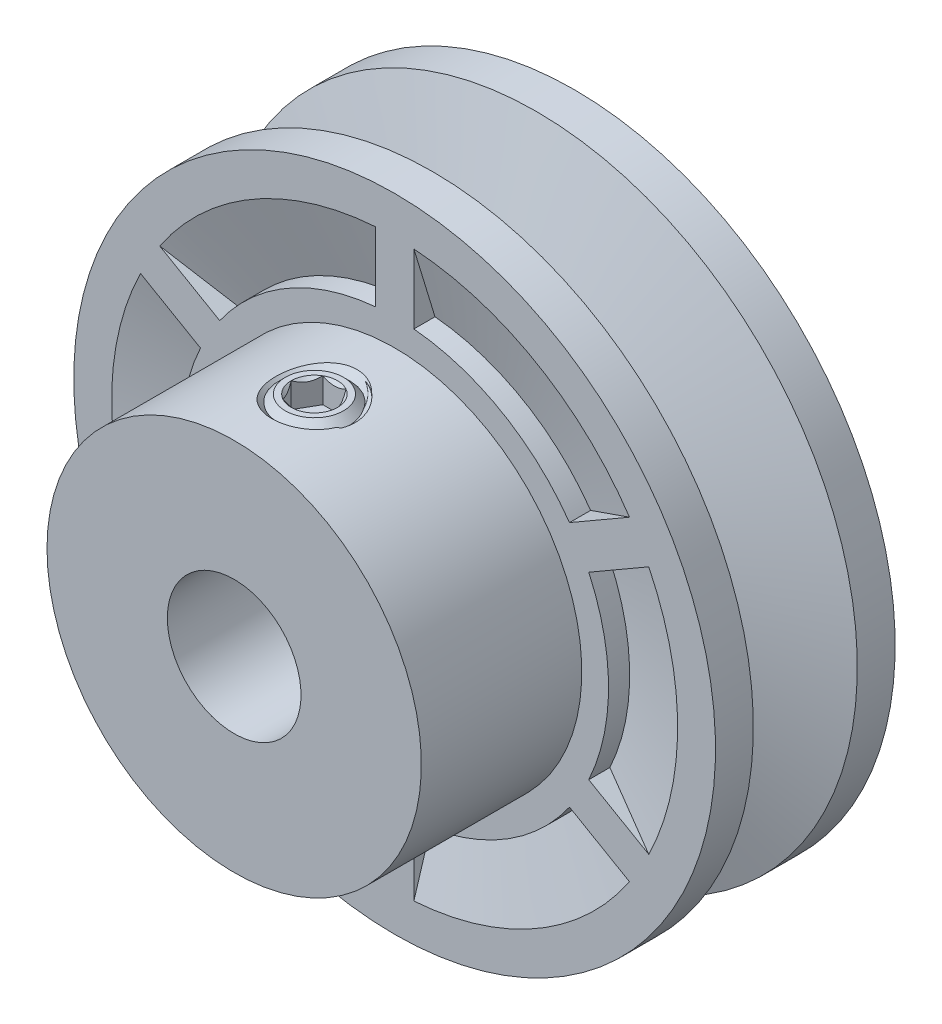
from build123d import *

# Parameters (mm, degrees)
BOSS_EXTRUDE1_DEPTH     = 1.143
CIRPATTERN1_COUNT       = 6
SKETCH4_R               = 3.96875
CUT_EXTRUDE1_DEPTH      = 22.225
CUT_EXTRUDE2_REACH      = 40.645
CUT_EXTRUDE2_END_RADIUS = 3.96875
SKETCH5_R               = 1.751541667
CUT_SWEEP1_PITCH        = 1.058333333
CUT_EXTRUDE4_DEPTH      = 1.48828125


with BuildPart() as part:
    # Sketch1 → Revolve1 (revolve)
    with BuildSketch(Plane(origin=(0, 0, 0), x_dir=(0, 0, -1), z_dir=(1, 0, 0)), mode=Mode.PRIVATE) as revolve1_sk:
        Polygon((3.0861, 19.05), (5.334, 19.05), (5.334, 16.8021), (4.079862172, 12.7), (5.334, 12.7), (5.334, 7.9375), (-5.334, 7.9375), (-5.334, 12.7), (-4.079862172, 12.7), (-5.334, 16.8021), (-5.334, 19.05), (-3.0861, 19.05), (-1.144710173, 12.7), (1.144710173, 12.7), align=None)
    revolve(revolve1_sk.sketch.rotate(Axis((0, 0, 14.859), (0, 0, -1)), 180), axis=Axis((0, 0, 14.859), (0, 0, -1)))

    # Sketch2 → Boss-Extrude1 (add, symmetric)
    with BuildSketch(Plane(origin=(0, 0, 0), x_dir=(0, 0, -1), z_dir=(1, 0, 0))):
        Polygon((-5.334, 16.8021), (-2.623819801, 7.9375), (-5.334, 7.9375), align=None)
        Polygon((5.334, 16.8021), (2.623819801, 7.9375), (5.334, 7.9375), align=None)
    boss_extrude1 = extrude(amount=BOSS_EXTRUDE1_DEPTH, both=True)

    # CirPattern1: Boss-Extrude1 ×6 about axis
    cirpattern1_axis = Axis((0, 0, 0), (0, 0, 1))
    for i in range(1, CIRPATTERN1_COUNT):
        add(boss_extrude1.rotate(cirpattern1_axis, i * 360 / CIRPATTERN1_COUNT))


with BuildPart() as body_2:
    # Sketch3 → Revolve2 (revolve)
    with BuildSketch(Plane(origin=(0, 0, 0), x_dir=(0, 0, -1), z_dir=(1, 0, 0)), mode=Mode.PRIVATE) as revolve2_sk:
        Polygon((7.366, 0), (7.366, 7.9375), (-5.334, 7.9375), (-5.334, 11.1125), (-14.859, 11.1125), (-14.859, 0), align=None)
    revolve(revolve2_sk.sketch.rotate(Axis((0, 0, -7.366), (0, 0, 1)), 90), axis=Axis((0, 0, -7.366), (0, 0, 1)))

    # Sketch4 → Cut-Extrude1 (cut)
    with BuildSketch(Plane(origin=(0, 0, -7.366), x_dir=(-1, 0, 0), z_dir=(0, 0, -1))):
        Circle(SKETCH4_R)
    extrude(amount=-CUT_EXTRUDE1_DEPTH, mode=Mode.SUBTRACT)

    # Cut-Extrude2: up to this cylinder (the profile starts outside it)
    cut_extrude2_end = Plane(origin=(0, 0, 10.0965), z_dir=(0, 0, -1)) * Cylinder(CUT_EXTRUDE2_END_RADIUS, 90.2275, mode=Mode.PRIVATE)
    # Sketch5 → Cut-Extrude2 (cut, up to the surface)
    with BuildSketch(Plane(origin=(0, 11.1125, 0), x_dir=(-1, 0, 0), z_dir=(0, 1, 0)), mode=Mode.PRIVATE) as cut_extrude2_sk1:
        with Locations(Location((0, 10.0965, 0), (0, 0, 90))):
            Circle(SKETCH5_R)
    cut_extrude2_tool1 = extrude(cut_extrude2_sk1.sketch, amount=-CUT_EXTRUDE2_REACH, mode=Mode.PRIVATE) - cut_extrude2_end
    add(cut_extrude2_tool1.solids().sort_by_distance((0, 11.1125, 10.0965))[0], mode=Mode.SUBTRACT)

    # Cut-Sweep1: the profile of Sketch7 screwed along a right-hand helix of 11.5 turns, 8 arcs to a turn; built about Z, then put on its axis
    cut_sweep1_z = Axis((0, 0, 0), (0, 0, 1))
    cut_sweep1_corners = [(1.668308364, 0, -1.025260417), (1.668308364, 0, -0.033072917), (2.413, 0, -0.463020833), (2.413, 0, -0.5953125)]
    with BuildLine(mode=Mode.PRIVATE) as cut_sweep1_profile:
        Line(cut_sweep1_corners[0], cut_sweep1_corners[1])
        Line(cut_sweep1_corners[1], cut_sweep1_corners[2])
        Line(cut_sweep1_corners[2], cut_sweep1_corners[3])
        Line(cut_sweep1_corners[3], cut_sweep1_corners[0])
    cut_sweep1_cap = Face(cut_sweep1_profile.wire())
    cut_sweep1_turn_angles = [0, 22.5, 45, 67.5, 90, 112.5, 135, 157.5, 180, 202.5, 225, 247.5, 270, 292.5, 315, 337.5, 360]
    cut_sweep1_turn_weights = [1, 0.9238795325112867, 1, 0.9238795325112867, 1, 0.9238795325112867, 1, 0.9238795325112867, 1, 0.9238795325112867, 1, 0.9238795325112867, 1, 0.9238795325112867, 1, 0.9238795325112867, 1]
    cut_sweep1_turn_rails = [Edge.make_bspline([Vector(p[0], p[1], 0).rotate(cut_sweep1_z, cut_sweep1_turn_angles[k]) / cut_sweep1_turn_weights[k] + Vector(0, 0, p[2] + CUT_SWEEP1_PITCH * cut_sweep1_turn_angles[k] / 360) for k in range(17)], [0, 0, 0, 1, 1, 2, 2, 3, 3, 4, 4, 5, 5, 6, 6, 7, 7, 8, 8, 8], 2, cut_sweep1_turn_weights) for p in cut_sweep1_corners]
    cut_sweep1_turn_sides = [Face.make_surface_from_curves(cut_sweep1_turn_rails[p[0]], cut_sweep1_turn_rails[p[1]]) for p in [(0, 1), (1, 2), (2, 3), (3, 0)]]
    cut_sweep1_last_angles = [3960, 3982.5, 4005, 4027.5, 4050, 4072.5, 4095, 4117.5, 4140]
    cut_sweep1_last_weights = [1, 0.9238795325112867, 1, 0.9238795325112867, 1, 0.9238795325112867, 1, 0.9238795325112867, 1]
    cut_sweep1_last_rails = [Edge.make_bspline([Vector(p[0], p[1], 0).rotate(cut_sweep1_z, cut_sweep1_last_angles[k]) / cut_sweep1_last_weights[k] + Vector(0, 0, p[2] + CUT_SWEEP1_PITCH * cut_sweep1_last_angles[k] / 360) for k in range(9)], [0, 0, 0, 1, 1, 2, 2, 3, 3, 4, 4, 4], 2, cut_sweep1_last_weights) for p in cut_sweep1_corners]
    cut_sweep1_last_sides = [Face.make_surface_from_curves(cut_sweep1_last_rails[p[0]], cut_sweep1_last_rails[p[1]]) for p in [(0, 1), (1, 2), (2, 3), (3, 0)]]
    cut_sweep1 = Plane(origin=(0, 11.1125, 10.0965), x_dir=(0, 0, 1), z_dir=(0, -1, 0)) * Solid(Shell([*[p.moved(Location((0, 0, CUT_SWEEP1_PITCH * i))) for i in range(11) for p in cut_sweep1_turn_sides], *cut_sweep1_last_sides, cut_sweep1_cap, cut_sweep1_cap.rotate(cut_sweep1_z, 4140).moved(Location((0, 0, CUT_SWEEP1_PITCH * 4140 / 360)))]))
    add(cut_sweep1, mode=Mode.SUBTRACT)

    # Cut-Extrude3 cone 1 section (through the dimple's axis) → Cut-Extrude3 (revolve, cut)
    with BuildSketch(Plane(origin=(0, 11.1125, 10.0965), x_dir=(0, 0, 1), z_dir=(1, 0, 0))):
        Polygon((0, 0), (2.527567944, 0), (0, 2.527567944), align=None)
    revolve(axis=Axis((0, 11.1125, 10.0965), (0, -1, 0)), mode=Mode.SUBTRACT)


with BuildPart() as body_3:
    # Sketch9 → Revolve3 (revolve)
    with BuildSketch(Plane(origin=(0, 0, 0), x_dir=(0, 0, -1), z_dir=(1, 0, 0))):
        Polygon((-12.5095, 5.449907664), (-12.5095, 10.425092336), (-11.822092336, 11.1125), (-10.0965, 11.1125), (-10.0965, 4.7625), (-11.822092336, 4.7625), align=None)
    revolve(axis=Axis((0, 11.1125, 10.0965), (0, -1, 0)))

    # Sketch10 → Cut-Extrude4 (cut)
    with BuildSketch(Plane(origin=(0, 11.1125, 0), x_dir=(1, 0, 0), z_dir=(0, 1, 0))):
        Polygon((1.374815329, -10.0965), (0.687407664, -8.905875), (-0.687407664, -8.905875), (-1.374815329, -10.0965), (-0.687407664, -11.287125), (0.687407664, -11.287125), align=None)
    extrude(amount=-CUT_EXTRUDE4_DEPTH, mode=Mode.SUBTRACT)

    # Cut-Extrude5 cone 1 section (through the dimple's axis) → Cut-Extrude5 (revolve, cut)
    with BuildSketch(Plane(origin=(0, 11.1125, 10.0965), x_dir=(0, 0, 1), z_dir=(1, 0, 0))):
        Polygon((0, 0), (1.374815329, 0), (0, 1.374815329), align=None)
    revolve(axis=Axis((0, 11.1125, 10.0965), (0, -1, 0)), mode=Mode.SUBTRACT)


solid = Compound([part.part, body_2.part, body_3.part])
